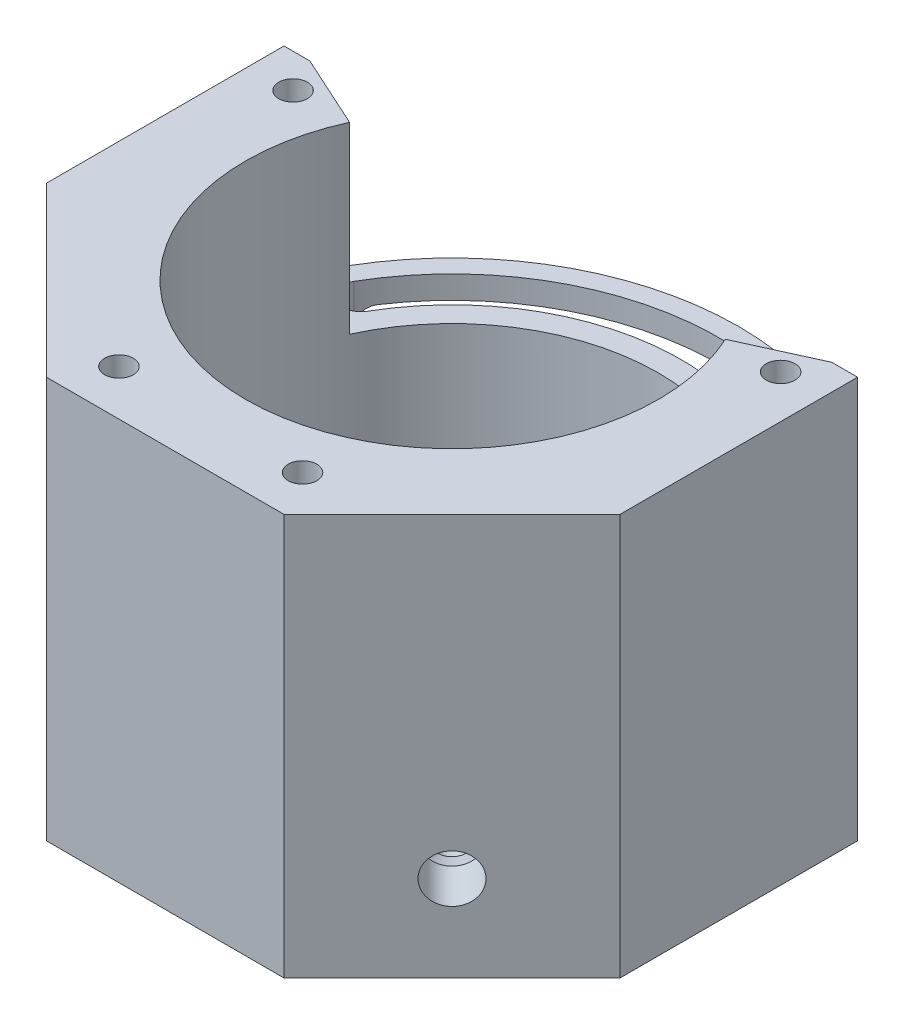
from build123d import *

# Parameters (mm, degrees)
BOSS_EXTRUDE1_DEPTH         = 35
CUT_EXTRUDE1_REACH          = 51.749
SKETCH2_R                   = 18
CUT_EXTRUDE2_DEPTH          = 22
CUT_EXTRUDE3_DEPTH          = 16
SKETCH5_W                   = 4.5
SKETCH5_H                   = 3
CUT_REVOLVE1_ANGLE          = 120
FILLET2_R                   = 1.5
CUT_EXTRUDE7_DEPTH          = 6.5
M3X0_25_TAPPED_HOLE1_REACH  = 71.769
M3X0_25_TAPPED_HOLE1_BORE_R = 1.375
M3X0_25_TAPPED_HOLE2_REACH  = 71.769
M3X0_25_TAPPED_HOLE2_BORE_R = 1.375
CUT_EXTRUDE8_REACH          = 71.769
CUT_EXTRUDE8_END_RADIUS     = 18
SKETCH15_R                  = 1.6
CUT_EXTRUDE9_REACH          = 71.769
CUT_EXTRUDE9_END_RADIUS     = 18
SKETCH16_R                  = 1.6
M5_TAPPED_HOLE3_D           = 4.2
M5_TAPPED_HOLE3_DEPTH       = 4.3
M5_TAPPED_HOLE3_TIP         = 1.2618073
M5_TAPPED_HOLE4_D           = 4.2
M5_TAPPED_HOLE4_DEPTH       = 4.3
M5_TAPPED_HOLE4_TIP         = 1.2618073
M3_TAPPED_HOLE1_D           = 2.5
M3_TAPPED_HOLE1_DEPTH       = 11.5
M3_TAPPED_HOLE1_TIP         = 0.751075774
FILLET3_R                   = 1.5


with BuildPart() as part:
    # Sketch1 → Boss-Extrude1 (new body)
    with BuildSketch(Plane(origin=(0, 0, 0), x_dir=(1, 0, 0), z_dir=(0, 1, 0))):
        Polygon((10.355339059, 25), (-10.355339059, 25), (-25, 10.355339059), (-25, -10.355339059), (-10.355339059, -25), (10.355339059, -25), (25, -10.355339059), (25, 10.355339059), align=None)
    extrude(amount=BOSS_EXTRUDE1_DEPTH)

    # Sketch2 → Cut-Extrude1 (cut, up to next)
    with BuildSketch(Plane(origin=(0, 35, 0), x_dir=(1, 0, 0), z_dir=(0, 1, 0)), mode=Mode.PRIVATE) as cut_extrude1_sk1:
        with Locations(Location((0, 0, 0), (0, 0, 270))):
            Circle(SKETCH2_R)
    cut_extrude1_tool1 = extrude(cut_extrude1_sk1.sketch, amount=-CUT_EXTRUDE1_REACH, mode=Mode.PRIVATE) & part.part
    add(cut_extrude1_tool1.solids().sort_by_distance((0, 35, 0))[0], mode=Mode.SUBTRACT)

    # Sketch3 → Cut-Extrude2 (cut)
    with BuildSketch(Plane(origin=(0, 35, 0), x_dir=(1, 0, 0), z_dir=(0, 1, 0))):
        with BuildLine():
            Line((-10.355339059, 25), (-17.677669284, 17.677669776))
            ThreePointArc((-17.677669284, 17.677669776), (-9.567085631, 23.096988387), (3.8e-08, 25))
            Line((3.8e-08, 25), (-10.355339059, 25))
        make_face()
        with BuildLine():
            Line((-17.677669284, 17.677669776), (-25, 10.355339059))
            Line((-25, 10.355339059), (-22.754493028, 10.355339059))
            ThreePointArc((-22.754493028, 10.355339059), (-20.544928062, 14.244505289), (-17.677669284, 17.677669776))
        make_face()
        with BuildLine():
            Line((10.355339059, 25), (3.8e-08, 25))
            ThreePointArc((3.8e-08, 25), (9.56708591, 23.096988271), (17.677669657, 17.677669402))
            Line((17.677669657, 17.677669402), (10.355339059, 25))
        make_face()
        with BuildLine():
            Line((25, 10.355339059), (17.677669657, 17.677669402))
            ThreePointArc((17.677669657, 17.677669402), (20.544928213, 14.244505072), (22.754493028, 10.355339059))
            Line((22.754493028, 10.355339059), (25, 10.355339059))
        make_face()
    extrude(amount=-CUT_EXTRUDE2_DEPTH, mode=Mode.SUBTRACT)

    # Sketch4 → Cut-Extrude3 (cut)
    with BuildSketch(Plane(origin=(0, 35, 0), x_dir=(1, 0, 0), z_dir=(0, 1, 0))):
        with BuildLine():
            Line((-16.38323498, 7.455844123), (-22.754493028, 10.355339059))
            ThreePointArc((-22.754493028, 10.355339059), (0, 25), (22.754493028, 10.355339059))
            Line((22.754493028, 10.355339059), (16.38323498, 7.455844123))
            ThreePointArc((16.38323498, 7.455844123), (0, 18), (-16.38323498, 7.455844123))
        make_face()
    extrude(amount=-CUT_EXTRUDE3_DEPTH, mode=Mode.SUBTRACT)

    # Sketch5 → Cut-Revolve1 (revolve, symmetric, cut)
    with BuildSketch(Plane(origin=(0, 0, 0), x_dir=(0, 0, -1), z_dir=(1, 0, 0))) as cut_revolve1_sk:
        with Locations((22.75, 15.5)):
            Rectangle(SKETCH5_W, SKETCH5_H)
    revolve(axis=Axis((0, 0, 0), (0, 1, 0)), revolution_arc=CUT_REVOLVE1_ANGLE / 2, mode=Mode.SUBTRACT)
    revolve(cut_revolve1_sk.sketch, axis=Axis((0, 0, 0), (0, -1, 0)), revolution_arc=CUT_REVOLVE1_ANGLE / 2, mode=Mode.SUBTRACT)

    # Fillet2
    fillet2_edges = [part.edges().sort_by_distance(p)[0] for p in [
        (19.702077936, 14, -11.375),
        (19.702077936, 17, -11.375),
        (-19.702077936, 17, -11.375),
        (-19.702077936, 14, -11.375),
    ]]
    fillet(fillet2_edges, radius=FILLET2_R - 0.0001)  # a hair under: the kernel refuses the full size

    # Sketch9 → Cut-Extrude7 (cut)
    with BuildSketch(Plane(origin=(0, 19, 0), x_dir=(1, 0, 0), z_dir=(0, 1, 0))):
        with BuildLine():
            ThreePointArc((20.178391908, 11.65), (0, 23.3), (-20.178391908, 11.65))
            ThreePointArc((-20.178391908, 11.65), (-19.574449992, 9.396058084), (-17.320508076, 10))
            ThreePointArc((-17.320508076, 10), (0, 20), (17.320508076, 10))
            ThreePointArc((17.320508076, 10), (19.574449992, 9.396058084), (20.178391908, 11.65))
        make_face()
    extrude(amount=-CUT_EXTRUDE7_DEPTH, mode=Mode.SUBTRACT)

    # M3x0.25 Tapped Hole1 bore → M3x0.25 Tapped Hole1 (cut, up to next)
    with BuildSketch(Plane(origin=(-17.67766953, 0, -17.67766953), x_dir=(-0.7071067811865472, 0, 0.7071067811865479), z_dir=(-0.7071067811865479, 0, -0.7071067811865472)), mode=Mode.PRIVATE) as m3x0_25_tapped_hole1_sk1:
        with Locations((0, 7.5)):
            Circle(M3X0_25_TAPPED_HOLE1_BORE_R)
    m3x0_25_tapped_hole1_tool1 = extrude(m3x0_25_tapped_hole1_sk1.sketch, amount=-M3X0_25_TAPPED_HOLE1_REACH, mode=Mode.PRIVATE) & part.part
    add(m3x0_25_tapped_hole1_tool1.solids().sort_by_distance((-17.67767, 7.5, -17.67767))[0], mode=Mode.SUBTRACT)

    # M3x0.25 Tapped Hole2 bore → M3x0.25 Tapped Hole2 (cut, up to next)
    with BuildSketch(Plane(origin=(17.67766953, 0, -17.67766953), x_dir=(-0.7071067811865475, 0, -0.7071067811865477), z_dir=(0.7071067811865477, 0, -0.7071067811865475)), mode=Mode.PRIVATE) as m3x0_25_tapped_hole2_sk1:
        with Locations((0, 7.5)):
            Circle(M3X0_25_TAPPED_HOLE2_BORE_R)
    m3x0_25_tapped_hole2_tool1 = extrude(m3x0_25_tapped_hole2_sk1.sketch, amount=-M3X0_25_TAPPED_HOLE2_REACH, mode=Mode.PRIVATE) & part.part
    add(m3x0_25_tapped_hole2_tool1.solids().sort_by_distance((17.67767, 7.5, -17.67767))[0], mode=Mode.SUBTRACT)

    # Cut-Extrude8: up to this cylinder (the profile starts outside it)
    cut_extrude8_end = Plane(origin=(0, 7.5, 0), z_dir=(0, 1, 0)) * Cylinder(CUT_EXTRUDE8_END_RADIUS, 180.538, mode=Mode.PRIVATE)
    # Sketch15 → Cut-Extrude8 (cut, up to the surface)
    with BuildSketch(Plane(origin=(17.67766953, 0, 17.67766953), x_dir=(0.7071067811865472, 0, -0.7071067811865479), z_dir=(0.7071067811865479, 0, 0.7071067811865472)), mode=Mode.PRIVATE) as cut_extrude8_sk1:
        with Locations((0, 7.5)):
            Circle(SKETCH15_R)
    cut_extrude8_tool1 = extrude(cut_extrude8_sk1.sketch, amount=-CUT_EXTRUDE8_REACH, mode=Mode.PRIVATE) - cut_extrude8_end
    add(cut_extrude8_tool1.solids().sort_by_distance((17.67767, 7.5, 17.67767))[0], mode=Mode.SUBTRACT)

    # Cut-Extrude9: up to this cylinder (the profile starts outside it)
    cut_extrude9_end = Plane(origin=(0, 7.5, 0), z_dir=(0, 1, 0)) * Cylinder(CUT_EXTRUDE9_END_RADIUS, 180.538, mode=Mode.PRIVATE)
    # Sketch16 → Cut-Extrude9 (cut, up to the surface)
    with BuildSketch(Plane(origin=(-17.67766953, 0, 17.67766953), x_dir=(0.7071067811865477, 0, 0.7071067811865475), z_dir=(-0.7071067811865475, 0, 0.7071067811865477)), mode=Mode.PRIVATE) as cut_extrude9_sk1:
        with Locations((0, 7.5)):
            Circle(SKETCH16_R)
    cut_extrude9_tool1 = extrude(cut_extrude9_sk1.sketch, amount=-CUT_EXTRUDE9_REACH, mode=Mode.PRIVATE) - cut_extrude9_end
    add(cut_extrude9_tool1.solids().sort_by_distance((-17.67767, 7.5, 17.67767))[0], mode=Mode.SUBTRACT)

    # M5 Tapped Hole3
    with Locations(Plane(origin=(-17.67766953, 0, 17.67766953), x_dir=(0.7071067811865477, 0, 0.7071067811865475), z_dir=(-0.7071067811865475, 0, 0.7071067811865477))):
        with Locations((0, 7.5)):
            Hole(M5_TAPPED_HOLE3_D / 2, depth=M5_TAPPED_HOLE3_DEPTH)
            with Locations((0, 0, -(M5_TAPPED_HOLE3_DEPTH + M5_TAPPED_HOLE3_TIP / 2))):  # 118° drill point
                Cone(0, M5_TAPPED_HOLE3_D / 2, M5_TAPPED_HOLE3_TIP, mode=Mode.SUBTRACT)

    # M5 Tapped Hole4
    with Locations(Plane(origin=(17.67766953, 0, 17.67766953), x_dir=(0.7071067811865472, 0, -0.7071067811865479), z_dir=(0.7071067811865479, 0, 0.7071067811865472))):
        with Locations((0, 7.5)):
            Hole(M5_TAPPED_HOLE4_D / 2, depth=M5_TAPPED_HOLE4_DEPTH)
            with Locations((0, 0, -(M5_TAPPED_HOLE4_DEPTH + M5_TAPPED_HOLE4_TIP / 2))):  # 118° drill point
                Cone(0, M5_TAPPED_HOLE4_D / 2, M5_TAPPED_HOLE4_TIP, mode=Mode.SUBTRACT)

    # M3 Tapped Hole1
    with Locations(Plane(origin=(0, 35, 0), x_dir=(1, 0, 0), z_dir=(0, 1, 0))):
        with Locations((-21.25, 7.395099729), (21.25, 7.395099729), (-8, -21.029740845), (8, -21.029740845)):
            Hole(M3_TAPPED_HOLE1_D / 2, depth=M3_TAPPED_HOLE1_DEPTH)
            with Locations((0, 0, -(M3_TAPPED_HOLE1_DEPTH + M3_TAPPED_HOLE1_TIP / 2))):  # 118° drill point
                Cone(0, M3_TAPPED_HOLE1_D / 2, M3_TAPPED_HOLE1_TIP, mode=Mode.SUBTRACT)

    # Fillet3
    fillet3_edges = [part.edges().sort_by_distance(p)[0] for p in [
        (22.754493028, 16, -10.355339059),
        (-22.754493028, 16, -10.355339059),
    ]]
    fillet(fillet3_edges, radius=FILLET3_R)


solid = part.part
